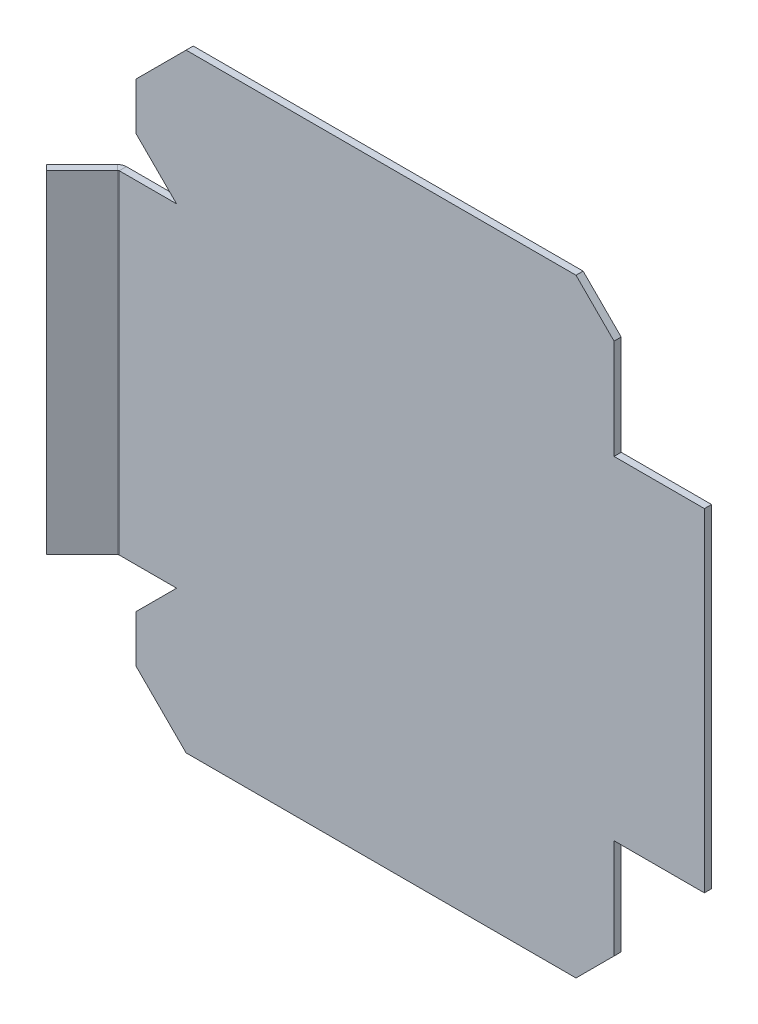
from build123d import *

# Parameters (mm, degrees)
BASE_FLANGE1_DEPTH     = 3
SKETCHED_BEND2_DEPTH   = 140
SKETCHED_BEND2_2_DEPTH = 140


# Read off the part's stored shape, not the designer's step: Sketched Bend2
# Sheet-metal steps are written as plain solids
with BuildPart() as part:
    # Sketch1 → Base-Flange1 (new body)
    with BuildSketch(Plane.XY):
        Polygon((0, 0), (0, 140), (47, 140), (30, 157), (30, 177), (51, 198), (215, 198), (231, 182), (231, 140), (269, 140), (269, 0), (231, 0), (231, -42), (215, -58), (51, -58), (30, -37), (30, -17), (47, 0), align=None)
    extrude(amount=-BASE_FLANGE1_DEPTH)

    # Sketched Bend2 outline → Sketched Bend2 (cut)
    with BuildSketch(Plane(origin=(0, 0, 0), x_dir=(1, 0, 0), z_dir=(0, 1, 0))):
        with BuildLine():
            Line((18.330560369, 0), (20.236135568, 1.905575199))
            ThreePointArc((20.236135568, 1.905575199), (21.448375853, 2.715568261), (22.878310766, 3))
            Line((22.878310766, 3), (0, 3))
            Line((0, 3), (0, 0))
            Line((0, 0), (18.330560369, 0))
        make_face()
    extrude(amount=SKETCHED_BEND2_DEPTH, mode=Mode.SUBTRACT)

    # Sketched Bend2 2 outline → Sketched Bend2 2 (add)
    with BuildSketch(Plane(origin=(0, 0, 0), x_dir=(1, 0, 0), z_dir=(0, 1, 0))):
        with BuildLine():
            Line((22.878310766, 0), (18.330560369, 0))
            Line((18.330560369, 0), (5.30084588, -13.029714489))
            Line((5.30084588, -13.029714489), (7.422166224, -15.151034832))
            Line((7.422166224, -15.151034832), (22.357455911, -0.215745145))
            ThreePointArc((22.357455911, -0.215745145), (22.59642615, -0.056070336), (22.878310766, 0))
        make_face()
    extrude(amount=SKETCHED_BEND2_2_DEPTH)


solid = part.part
